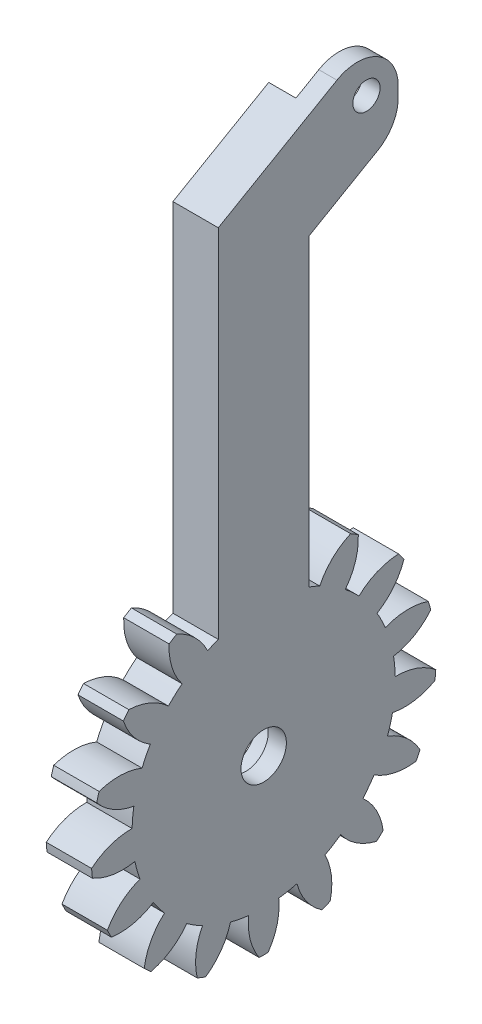
from build123d import *

# Parameters (mm, degrees)
BASPROSKE_W             = 10
BASPROSKE_H             = 19
TOOTHCUT_DEPTH          = 29.670542374
TEETHCUTS_COUNT         = 17
TEETHCUTS_ANGLE         = 338.823529412
BORSKE_R                = 2.5
BORE_DEPTH              = 50.0018288
CUT_EXTRUDE1_DEPTH      = 20
CUT_EXTRUDE1_DEPTH_BACK = 20
SKETCH1_W               = 10
SKETCH1_H               = 40
BOSS_EXTRUDE1_DEPTH     = 5
CUT_EXTRUDE2_START      = -3
SKETCH5_R               = 4.75
SKETCH5_R_2             = 2.5
CUT_EXTRUDE2_DEPTH      = 3
SKETCH6_R               = 1.5
CUT_EXTRUDE3_DEPTH      = 68.251600881
CUT_EXTRUDE4_DEPTH      = 3
FILLET1_R               = 4.5
FILLET2_R               = 4.5


with BuildPart() as part:
    # BasProSke → Base-Revolve (revolve)
    with BuildSketch(Plane(origin=(0, 0, 0), x_dir=(1, 0, 0), z_dir=(0, 1, 0))):
        with Locations((5, 9.5)):
            Rectangle(BASPROSKE_W, BASPROSKE_H)
    revolve(axis=Axis((-10, 0, 0), (1, 0, 0)))

    # TooCutSke → ToothCut (cut, through all)
    with BuildSketch(Plane(origin=(0, 0, 0), x_dir=(0, 0, -1), z_dir=(1, 0, 0))):
        with BuildLine():
            ThreePointArc((1.020352389, 14.463052306), (0, 14.499), (-1.020352389, 14.463052306))
            ThreePointArc((-1.020352389, 14.463052306), (-1.632621885, 16.804485203), (-3.026143023, 18.783192049))
            ThreePointArc((-3.026143023, 18.783192049), (0, 19.0254), (3.026143023, 18.783192049))
            ThreePointArc((3.026143023, 18.783192049), (1.632621885, 16.804485203), (1.020352389, 14.463052306))
        make_face()
    toothcut = extrude(amount=TOOTHCUT_DEPTH, mode=Mode.SUBTRACT)

    # TeethCuts: ToothCut ×17 about axis
    teethcuts_axis = Axis((-10, 0, 0), (1, 0, 0))
    for i in range(1, TEETHCUTS_COUNT):
        add(toothcut.rotate(teethcuts_axis, i * TEETHCUTS_ANGLE / (TEETHCUTS_COUNT - 1)), mode=Mode.SUBTRACT)

    # BorSke → Bore (cut, symmetric)
    with BuildSketch(Plane(origin=(0, 0, 0), x_dir=(0, 0, -1), z_dir=(1, 0, 0))):
        Circle(BORSKE_R)
    extrude(amount=BORE_DEPTH, both=True, mode=Mode.SUBTRACT)

    # Sketch1 → Cut-Extrude1 (cut, two sides: drawn at the far end of the back side and taken through both)
    with BuildSketch(Plane.XY.offset(-CUT_EXTRUDE1_DEPTH_BACK)):
        Rectangle(SKETCH1_W, SKETCH1_H)
    extrude(amount=CUT_EXTRUDE1_DEPTH + CUT_EXTRUDE1_DEPTH_BACK, mode=Mode.SUBTRACT)

    # Sketch4 → Boss-Extrude1 (add)
    with BuildSketch(Plane(origin=(10, 0, 0), x_dir=(0, 0, -1), z_dir=(1, 0, 0))):
        with BuildLine():
            Line((5, 0), (5, 47.113248654))
            Line((5, 47.113248654), (14.820508076, 52.783121635))
            Line((14.820508076, 52.783121635), (14.820508076, 64.330127019))
            Line((14.820508076, 64.330127019), (-5, 52.886751346))
            Line((-5, 52.886751346), (-5, 0))
            Line((-5, 0), (-2.5, 0))
            ThreePointArc((-2.5, 0), (0, 2.5), (2.5, 0))
            Line((2.5, 0), (5, 0))
        make_face()
    extrude(amount=-BOSS_EXTRUDE1_DEPTH)

    # Sketch5 → Cut-Extrude2 (cut)
    with BuildSketch(Plane.ZY.offset(-5).offset(CUT_EXTRUDE2_START)):
        Circle(SKETCH5_R)
        Circle(SKETCH5_R_2, mode=Mode.SUBTRACT)
    extrude(amount=CUT_EXTRUDE2_DEPTH, mode=Mode.SUBTRACT)

    # Sketch6 → Cut-Extrude3 (cut, through all)
    with BuildSketch(Plane.ZY.offset(-5)):
        with Locations((-11.320508076, 57.330127019)):
            Circle(SKETCH6_R)
    extrude(amount=-CUT_EXTRUDE3_DEPTH, mode=Mode.SUBTRACT)

    # Sketch7 → Cut-Extrude4 (cut)
    with BuildSketch(Plane.ZY.offset(-5)):
        with BuildLine():
            Line((-21.855234833, 56.484151118), (-14.320508076, 52.133974596))
            ThreePointArc((-14.320508076, 52.133974596), (-6.124355653, 54.330127019), (-8.320508076, 62.526279442))
            Line((-8.320508076, 62.526279442), (-15.855234833, 66.876455963))
            Line((-15.855234833, 66.876455963), (-21.855234833, 56.484151118))
        make_face()
    extrude(amount=-CUT_EXTRUDE4_DEPTH, mode=Mode.SUBTRACT)

    # Fillet1
    fillet1_edges = [part.edges().sort_by_distance(p)[0] for p in [
        (9, 52.783121635, -14.820508076),
        (9, 64.330127019, -14.820508076),
    ]]
    fillet(fillet1_edges, radius=FILLET1_R)

    # Fillet2
    fillet2_edges = [part.edges().sort_by_distance(p)[0] for p in [
        (6.5, 51.449252752, -12.5101794),
    ]]
    fillet(fillet2_edges, radius=FILLET2_R)


solid = part.part
